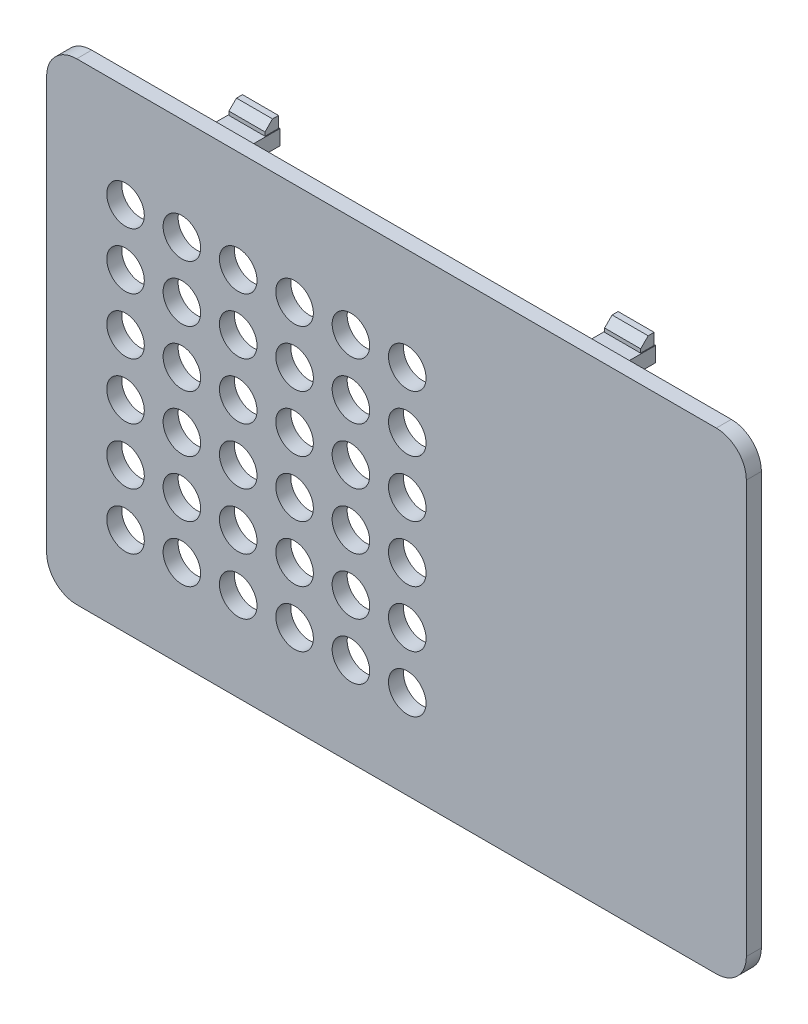
from build123d import *

# Parameters (mm, degrees)
BOSS_EXTRUDE2_DEPTH = 2
BOSS_EXTRUDE3_DEPTH = 2
CHAMFER1_SIZE       = 2
CHAMFER1_SIZE_2     = 1
SKETCH3_W           = 5
SKETCH3_H           = 2
BOSS_EXTRUDE4_DEPTH = 5
SKETCH4_W           = 4.8
SKETCH4_H           = 1.8
BOSS_EXTRUDE5_DEPTH = 1.5
BOSS_EXTRUDE6_START = -59.92
SKETCH4_2_W         = 4.8
SKETCH4_2_H         = 1.8
BOSS_EXTRUDE6_DEPTH = 1.5
CHAMFER2_SIZE       = 1
SKETCH5_R           = 2.5
CUT_EXTRUDE1_DEPTH  = 2


with BuildPart() as part:
    # Sketch2 → Boss-Extrude2 (new body)
    # profile 1 of 3: a face of its own
    with BuildSketch(Plane.XY):
        with BuildLine():
            Line((-18.805, 55.401544778), (-42.565, 55.401544778))
            ThreePointArc((-42.565, 55.401544778), (-45.393427125, 54.229971902), (-46.565, 51.401544778))
            Line((-46.565, 51.401544778), (-46.565, -3.518455222))
            ThreePointArc((-46.565, -3.518455222), (-45.393427125, -6.346882347), (-42.565, -7.518455222))
            Line((-42.565, -7.518455222), (42.565, -7.518455222))
            ThreePointArc((42.565, -7.518455222), (45.393427125, -6.346882347), (46.565, -3.518455222))
            Line((46.565, -3.518455222), (46.565, 51.401544778))
            ThreePointArc((46.565, 51.401544778), (45.393427125, 54.229971902), (42.565, 55.401544778))
            Line((42.565, 55.401544778), (2.595, 55.401544778))
            Line((2.595, 55.401544778), (1.595, 55.401544778))
            Line((1.595, 55.401544778), (-17.805, 55.401544778))
            Line((-17.805, 55.401544778), (-18.805, 55.401544778))
        make_face()
        with BuildLine():
            ThreePointArc((-41.065, 53.901544778), (-43.893427125, 52.729971902), (-45.065, 49.901544778))
            Line((-45.065, 49.901544778), (-45.065, -2.018455222))
            ThreePointArc((-45.065, -2.018455222), (-43.893427125, -4.846882347), (-41.065, -6.018455222))
            Line((-41.065, -6.018455222), (41.065, -6.018455222))
            ThreePointArc((41.065, -6.018455222), (43.893427125, -4.846882347), (45.065, -2.018455222))
            Line((45.065, -2.018455222), (45.065, 49.901544778))
            ThreePointArc((45.065, 49.901544778), (43.893427125, 52.729971902), (41.065, 53.901544778))
            Line((41.065, 53.901544778), (-41.065, 53.901544778))
        make_face(mode=Mode.SUBTRACT)
    # profile 2 of 3: a face of its own
    with BuildSketch(Plane.XY):
        with BuildLine():
            Line((41.065, 53.901544778), (-41.065, 53.901544778))
            ThreePointArc((-41.065, 53.901544778), (-43.893427125, 52.729971902), (-45.065, 49.901544778))
            Line((-45.065, 49.901544778), (-45.065, -2.018455222))
            ThreePointArc((-45.065, -2.018455222), (-43.893427125, -4.846882347), (-41.065, -6.018455222))
            Line((-41.065, -6.018455222), (41.065, -6.018455222))
            ThreePointArc((41.065, -6.018455222), (43.893427125, -4.846882347), (45.065, -2.018455222))
            Line((45.065, -2.018455222), (45.065, 49.901544778))
            ThreePointArc((45.065, 49.901544778), (43.893427125, 52.729971902), (41.065, 53.901544778))
        make_face()
        with BuildLine():
            ThreePointArc((41.065, -4.018455222), (42.479213562, -3.432668785), (43.065, -2.018455222))
            Line((43.065, -2.018455222), (43.065, 49.901544778))
            ThreePointArc((43.065, 49.901544778), (42.479213562, 51.31575834), (41.065, 51.901544778))
            Line((41.065, 51.901544778), (-41.065, 51.901544778))
            ThreePointArc((-41.065, 51.901544778), (-42.479213562, 51.31575834), (-43.065, 49.901544778))
            Line((-43.065, 49.901544778), (-43.065, -2.018455222))
            ThreePointArc((-43.065, -2.018455222), (-42.479213562, -3.432668785), (-41.065, -4.018455222))
            Line((-41.065, -4.018455222), (41.065, -4.018455222))
        make_face(mode=Mode.SUBTRACT)
    # profile 3 of 3: a face of its own
    with BuildSketch(Plane.XY):
        with BuildLine():
            Line((-41.065, -4.018455222), (41.065, -4.018455222))
            ThreePointArc((41.065, -4.018455222), (42.479213562, -3.432668785), (43.065, -2.018455222))
            Line((43.065, -2.018455222), (43.065, 49.901544778))
            ThreePointArc((43.065, 49.901544778), (42.479213562, 51.31575834), (41.065, 51.901544778))
            Line((41.065, 51.901544778), (-41.065, 51.901544778))
            ThreePointArc((-41.065, 51.901544778), (-42.479213562, 51.31575834), (-43.065, 49.901544778))
            Line((-43.065, 49.901544778), (-43.065, -2.018455222))
            ThreePointArc((-43.065, -2.018455222), (-42.479213562, -3.432668785), (-41.065, -4.018455222))
        make_face()
    extrude(amount=BOSS_EXTRUDE2_DEPTH)

    # Sketch2<3> → Boss-Extrude3 (add)
    with BuildSketch(Plane.XY):
        with BuildLine():
            Line((41.065, 53.901544778), (-41.065, 53.901544778))
            ThreePointArc((-41.065, 53.901544778), (-43.893427125, 52.729971902), (-45.065, 49.901544778))
            Line((-45.065, 49.901544778), (-45.065, -2.018455222))
            ThreePointArc((-45.065, -2.018455222), (-43.893427125, -4.846882347), (-41.065, -6.018455222))
            Line((-41.065, -6.018455222), (41.065, -6.018455222))
            ThreePointArc((41.065, -6.018455222), (43.893427125, -4.846882347), (45.065, -2.018455222))
            Line((45.065, -2.018455222), (45.065, 49.901544778))
            ThreePointArc((45.065, 49.901544778), (43.893427125, 52.729971902), (41.065, 53.901544778))
        make_face()
        with BuildLine():
            ThreePointArc((41.065, -4.018455222), (42.479213562, -3.432668785), (43.065, -2.018455222))
            Line((43.065, -2.018455222), (43.065, 49.901544778))
            ThreePointArc((43.065, 49.901544778), (42.479213562, 51.31575834), (41.065, 51.901544778))
            Line((41.065, 51.901544778), (-41.065, 51.901544778))
            ThreePointArc((-41.065, 51.901544778), (-42.479213562, 51.31575834), (-43.065, 49.901544778))
            Line((-43.065, 49.901544778), (-43.065, -2.018455222))
            ThreePointArc((-43.065, -2.018455222), (-42.479213562, -3.432668785), (-41.065, -4.018455222))
            Line((-41.065, -4.018455222), (41.065, -4.018455222))
        make_face(mode=Mode.SUBTRACT)
    extrude(amount=-BOSS_EXTRUDE3_DEPTH)

    # Chamfer1
    # the kernel refuses this chamfer: 2, 1 mm, written as the material it takes off along each edge
    with BuildSketch(Plane(origin=(41.065, 53.901544778, -2), x_dir=(0, 0.017268075123669586, 0.9998508956747119), z_dir=(-1, 0, 0))) as chamfer1_piece_1_section:
        Polygon((CHAMFER1_SIZE * 0.999850895675, -CHAMFER1_SIZE * 0.0172680751237), (-CHAMFER1_SIZE_2 * 0.0172680751237, -CHAMFER1_SIZE_2 * 0.999850895675), (0, 0), align=None)
    chamfer1_piece_1 = extrude(amount=82.13, mode=Mode.PRIVATE)
    chamfer1_piece_1 = split(chamfer1_piece_1, bisect_by=Plane(origin=(0, 53.583058293, 0), z_dir=(0, 0, -1)), keep=Keep.TOP, mode=Mode.PRIVATE)
    add(chamfer1_piece_1, mode=Mode.SUBTRACT)
    with BuildSketch(Plane(origin=(-41.065, 49.901544778, -2), x_dir=(0, 1, 0), z_dir=(1, 0, 0))) as chamfer1_piece_2_section:
        Polygon((4, CHAMFER1_SIZE), (4 - CHAMFER1_SIZE_2, 0), (4, 0), align=None)
    chamfer1_piece_2 = revolve(axis=Axis((-41.065, 49.901544778, -2), (0, 0, 1)), revolution_arc=90, mode=Mode.PRIVATE)
    chamfer1_piece_2 = split(chamfer1_piece_2, bisect_by=Plane(origin=(-43.539094685, 52.375639463, 0), z_dir=(0, 0, -1)), keep=Keep.TOP, mode=Mode.PRIVATE)
    add(chamfer1_piece_2, mode=Mode.SUBTRACT)
    with BuildSketch(Plane(origin=(41.065, 49.901544778, -2), x_dir=(1, 0, 0), z_dir=(0, -1, 0))) as chamfer1_piece_3_section:
        Polygon((4, CHAMFER1_SIZE), (4 - CHAMFER1_SIZE_2, 0), (4, 0), align=None)
    chamfer1_piece_3 = revolve(axis=Axis((41.065, 49.901544778, -2), (0, 0, 1)), revolution_arc=90, mode=Mode.PRIVATE)
    chamfer1_piece_3 = split(chamfer1_piece_3, bisect_by=Plane(origin=(43.539094685, 52.375639463, 0), z_dir=(0, 0, -1)), keep=Keep.TOP, mode=Mode.PRIVATE)
    add(chamfer1_piece_3, mode=Mode.SUBTRACT)
    with BuildSketch(Plane(origin=(-45.065, 49.901544778, -2), x_dir=(-0.017268075123669586, 0, 0.9998508956747119), z_dir=(0, -1, 0))) as chamfer1_piece_4_section:
        Polygon((CHAMFER1_SIZE * 0.999850895675, -CHAMFER1_SIZE * 0.0172680751237), (-CHAMFER1_SIZE_2 * 0.0172680751237, -CHAMFER1_SIZE_2 * 0.999850895675), (0, 0), align=None)
    chamfer1_piece_4 = extrude(amount=51.92, mode=Mode.PRIVATE)
    chamfer1_piece_4 = split(chamfer1_piece_4, bisect_by=Plane(origin=(-44.746513515, 23.941544778, 0), z_dir=(0, 0, -1)), keep=Keep.TOP, mode=Mode.PRIVATE)
    add(chamfer1_piece_4, mode=Mode.SUBTRACT)
    with BuildSketch(Plane(origin=(45.065, -2.018455222, -2), x_dir=(0.017268075123669586, 0, 0.9998508956747119), z_dir=(0, 1, 0))) as chamfer1_piece_5_section:
        Polygon((CHAMFER1_SIZE * 0.999850895675, -CHAMFER1_SIZE * 0.0172680751237), (-CHAMFER1_SIZE_2 * 0.0172680751237, -CHAMFER1_SIZE_2 * 0.999850895675), (0, 0), align=None)
    chamfer1_piece_5 = extrude(amount=51.92, mode=Mode.PRIVATE)
    chamfer1_piece_5 = split(chamfer1_piece_5, bisect_by=Plane(origin=(44.746513515, 23.941544778, 0), z_dir=(0, 0, -1)), keep=Keep.TOP, mode=Mode.PRIVATE)
    add(chamfer1_piece_5, mode=Mode.SUBTRACT)
    with BuildSketch(Plane(origin=(-41.065, -2.018455222, -2), x_dir=(-1, 0, 0), z_dir=(0, 1, 0))) as chamfer1_piece_6_section:
        Polygon((4, CHAMFER1_SIZE), (4 - CHAMFER1_SIZE_2, 0), (4, 0), align=None)
    chamfer1_piece_6 = revolve(axis=Axis((-41.065, -2.018455222, -2), (0, 0, 1)), revolution_arc=90, mode=Mode.PRIVATE)
    chamfer1_piece_6 = split(chamfer1_piece_6, bisect_by=Plane(origin=(-43.539094685, -4.492549907, 0), z_dir=(0, 0, -1)), keep=Keep.TOP, mode=Mode.PRIVATE)
    add(chamfer1_piece_6, mode=Mode.SUBTRACT)
    with BuildSketch(Plane(origin=(41.065, -2.018455222, -2), x_dir=(0, -1, 0), z_dir=(-1, 0, 0))) as chamfer1_piece_7_section:
        Polygon((4, CHAMFER1_SIZE), (4 - CHAMFER1_SIZE_2, 0), (4, 0), align=None)
    chamfer1_piece_7 = revolve(axis=Axis((41.065, -2.018455222, -2), (0, 0, 1)), revolution_arc=90, mode=Mode.PRIVATE)
    chamfer1_piece_7 = split(chamfer1_piece_7, bisect_by=Plane(origin=(43.539094685, -4.492549907, 0), z_dir=(0, 0, -1)), keep=Keep.TOP, mode=Mode.PRIVATE)
    add(chamfer1_piece_7, mode=Mode.SUBTRACT)
    with BuildSketch(Plane(origin=(-41.065, -6.018455222, -2), x_dir=(0, -0.0172680751236683, 0.9998508956747119), z_dir=(1, 0, 0))) as chamfer1_piece_8_section:
        Polygon((CHAMFER1_SIZE * 0.999850895675, -CHAMFER1_SIZE * 0.0172680751237), (-CHAMFER1_SIZE_2 * 0.0172680751237, -CHAMFER1_SIZE_2 * 0.999850895675), (0, 0), align=None)
    chamfer1_piece_8 = extrude(amount=82.13, mode=Mode.PRIVATE)
    chamfer1_piece_8 = split(chamfer1_piece_8, bisect_by=Plane(origin=(0, -5.699968737, 0), z_dir=(0, 0, -1)), keep=Keep.TOP, mode=Mode.PRIVATE)
    add(chamfer1_piece_8, mode=Mode.SUBTRACT)

    # Sketch3 → Boss-Extrude4 (add)
    with BuildSketch(Plane(origin=(0, 0, 0), x_dir=(-1, 0, 0), z_dir=(0, 0, -1))):
        with Locations((25, 52.901544778)):
            Rectangle(SKETCH3_W, SKETCH3_H)
        with Locations((25, -5.018455222)):
            Rectangle(SKETCH3_W, SKETCH3_H)
        with Locations((-25, -5.018455222)):
            Rectangle(SKETCH3_W, SKETCH3_H)
        with Locations((-25, 52.901544778)):
            Rectangle(SKETCH3_W, SKETCH3_H)
    extrude(amount=BOSS_EXTRUDE4_DEPTH)

    # Sketch4 → Boss-Extrude5 (add)
    with BuildSketch(Plane(origin=(0, 53.901544778, 0), x_dir=(1, 0, 0), z_dir=(0, 1, 0))):
        with Locations((25, 4)):
            Rectangle(SKETCH4_W, SKETCH4_H)
        with Locations((-25, 4)):
            Rectangle(SKETCH4_W, SKETCH4_H)
    extrude(amount=BOSS_EXTRUDE5_DEPTH)

    # Sketch4<2> → Boss-Extrude6 (add)
    with BuildSketch(Plane(origin=(0, 53.901544778, 0), x_dir=(1, 0, 0), z_dir=(0, 1, 0)).offset(BOSS_EXTRUDE6_START)):
        with Locations((25, 4)):
            Rectangle(SKETCH4_2_W, SKETCH4_2_H)
        with Locations((-25, 4)):
            Rectangle(SKETCH4_2_W, SKETCH4_2_H)
    extrude(amount=-BOSS_EXTRUDE6_DEPTH)

    # Chamfer2
    chamfer2_edges = [part.edges().sort_by_distance(p)[0] for p in [
        (-25, 55.401544778, -3.1),
        (25, 55.401544778, -3.1),
        (-25, -7.518455222, -3.1),
        (25, -7.518455222, -3.1),
    ]]
    chamfer(chamfer2_edges, length=CHAMFER2_SIZE)

    # Sketch5 → Cut-Extrude1 (cut)
    with BuildSketch(Plane.XY.offset(2)):
        with Locations((1.435, 41.831544778)):
            Circle(SKETCH5_R)
        with Locations((-6.065, 41.831544778)):
            Circle(SKETCH5_R)
        with Locations((-13.565, 41.831544778)):
            Circle(SKETCH5_R)
        with Locations((-21.065, 41.831544778)):
            Circle(SKETCH5_R)
        with Locations((-28.565, 41.831544778)):
            Circle(SKETCH5_R)
        with Locations((-36.065, 41.831544778)):
            Circle(SKETCH5_R)
        with Locations((-36.065, 34.331544778)):
            Circle(SKETCH5_R)
        with Locations((-28.565, 34.331544778)):
            Circle(SKETCH5_R)
        with Locations((-21.065, 34.331544778)):
            Circle(SKETCH5_R)
        with Locations((-13.565, 34.331544778)):
            Circle(SKETCH5_R)
        with Locations((-6.065, 34.331544778)):
            Circle(SKETCH5_R)
        with Locations((1.435, 34.331544778)):
            Circle(SKETCH5_R)
        with Locations((1.435, 26.831544778)):
            Circle(SKETCH5_R)
        with Locations((-6.065, 26.831544778)):
            Circle(SKETCH5_R)
        with Locations((-13.565, 26.831544778)):
            Circle(SKETCH5_R)
        with Locations((-21.065, 26.831544778)):
            Circle(SKETCH5_R)
        with Locations((-28.565, 26.831544778)):
            Circle(SKETCH5_R)
        with Locations((-36.065, 26.831544778)):
            Circle(SKETCH5_R)
        with Locations((-36.065, 19.331544778)):
            Circle(SKETCH5_R)
        with Locations((-28.565, 19.331544778)):
            Circle(SKETCH5_R)
        with Locations((-21.065, 19.331544778)):
            Circle(SKETCH5_R)
        with Locations((-13.565, 19.331544778)):
            Circle(SKETCH5_R)
        with Locations((-6.065, 19.331544778)):
            Circle(SKETCH5_R)
        with Locations((1.435, 19.331544778)):
            Circle(SKETCH5_R)
        with Locations((1.435, 11.831544778)):
            Circle(SKETCH5_R)
        with Locations((-6.065, 11.831544778)):
            Circle(SKETCH5_R)
        with Locations((-13.565, 11.831544778)):
            Circle(SKETCH5_R)
        with Locations((-21.065, 11.831544778)):
            Circle(SKETCH5_R)
        with Locations((-28.565, 11.831544778)):
            Circle(SKETCH5_R)
        with Locations((-36.065, 11.831544778)):
            Circle(SKETCH5_R)
        with Locations((-36.065, 4.331544778)):
            Circle(SKETCH5_R)
        with Locations((-28.565, 4.331544778)):
            Circle(SKETCH5_R)
        with Locations((-21.065, 4.331544778)):
            Circle(SKETCH5_R)
        with Locations((-13.565, 4.331544778)):
            Circle(SKETCH5_R)
        with Locations((-6.065, 4.331544778)):
            Circle(SKETCH5_R)
        with Locations((1.435, 4.331544778)):
            Circle(SKETCH5_R)
    extrude(amount=-CUT_EXTRUDE1_DEPTH, mode=Mode.SUBTRACT)


solid = part.part
